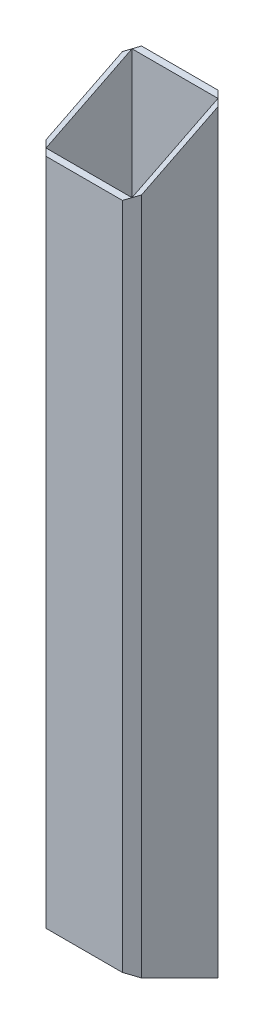
from build123d import *

# Parameters (mm, degrees)
SKETCH1_W           = 50
SKETCH1_H           = 400
BOSS_EXTRUDE2_DEPTH = 50
SKETCH2_W           = 45
SKETCH2_H           = 45
CUT_EXTRUDE1_DEPTH  = 407.201920232
CUT_EXTRUDE2_DEPTH  = 407.201920232
CHAMFER1_SIZE       = 5


with BuildPart() as part:
    # Sketch1 → Boss-Extrude2 (new body)
    with BuildSketch(Plane.XY):
        with Locations((25, 200)):
            Rectangle(SKETCH1_W, SKETCH1_H)
    extrude(amount=BOSS_EXTRUDE2_DEPTH)

    # Sketch2 → Cut-Extrude1 (cut, through all)
    with BuildSketch(Plane.XZ):
        with Locations((25, 25)):
            Rectangle(SKETCH2_W, SKETCH2_H)
    extrude(amount=-CUT_EXTRUDE1_DEPTH, mode=Mode.SUBTRACT)

    # Sketch3 → Cut-Extrude2 (cut, through all)
    with BuildSketch(Plane.ZY):
        Polygon((0, 400), (50, 400), (50, 375), align=None)
        Polygon((0, 0), (50, 0), (50, 25), align=None)
    extrude(amount=-CUT_EXTRUDE2_DEPTH, mode=Mode.SUBTRACT)

    # Chamfer1
    chamfer1_edges = [part.edges().sort_by_distance(p)[0] for p in [
        (0, 200, 50),
        (50, 200, 50),
        (50, 200, 0),
        (0, 200, 0),
    ]]
    chamfer(chamfer1_edges, length=CHAMFER1_SIZE - 0.0001)  # a hair under: the kernel refuses the full size


solid = part.part
